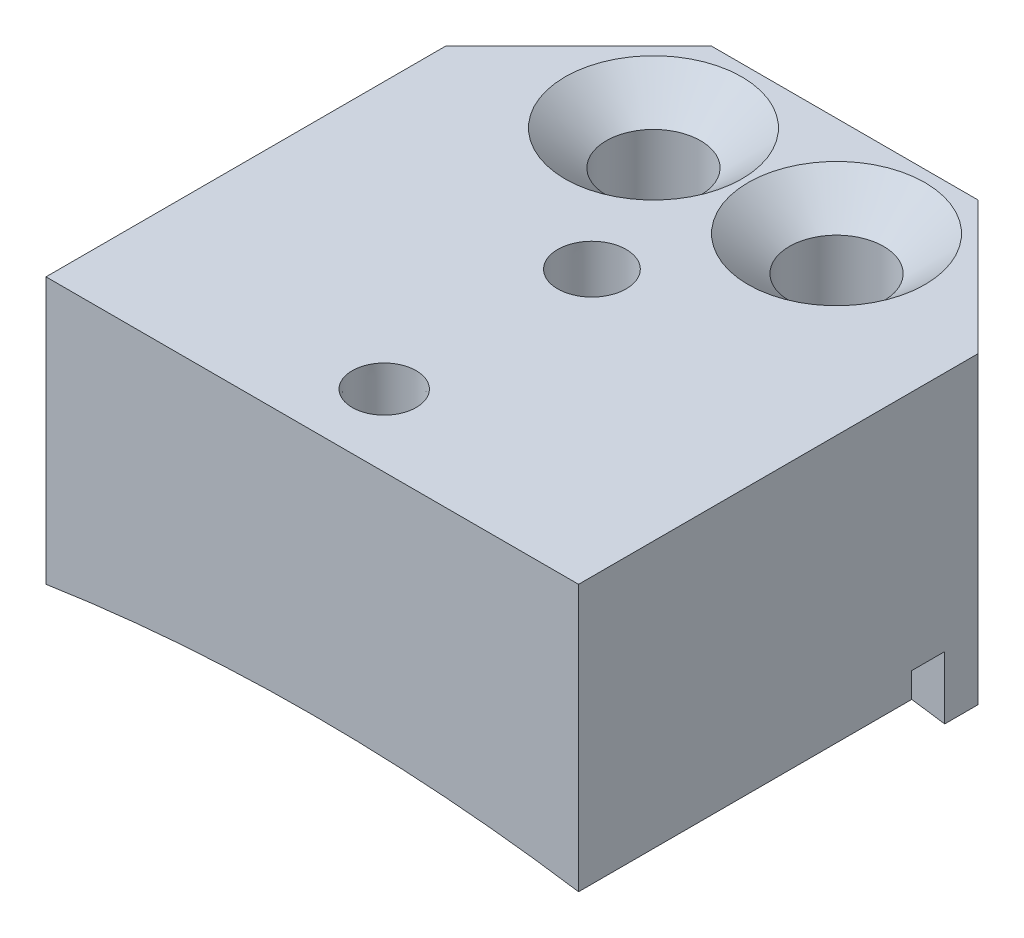
from build123d import *

# Parameters (mm, degrees)
BOSS_EXTRUDE1_DEPTH                               = 12.7
CUT_EXTRUDE1_DEPTH                                = 41.241448839
CUT_EXTRUDE1_DEPTH_BACK                           = 41.241448839
SKETCH2_R                                         = 83.82
BOSS_EXTRUDE2_DEPTH                               = 7.9375
CHAMFER1_SIZE                                     = 6.35
CSK_FOR_8_FLAT_HEAD_MACHINE_SCREW_100_D           = 4.4958
CSK_FOR_8_FLAT_HEAD_MACHINE_SCREW_100_CSINK_D     = 8.4328
CSK_FOR_8_FLAT_HEAD_MACHINE_SCREW_100_CSINK_ANGLE = 100
CUT_EXTRUDE2_DEPTH                                = 35.469591438
SKETCH7_W                                         = 1.5875
SKETCH7_H                                         = 1.190625
CUT_EXTRUDE3_DEPTH                                = 32.168108704


with BuildPart() as part:
    # Sketch1 → Boss-Extrude1 (new body)
    with BuildSketch(Plane(origin=(0, 0, 0), x_dir=(1, 0, 0), z_dir=(0, 1, 0))):
        Polygon((-28.511825699, 6.495271113), (-22.161825699, 12.845271113), (-9.461825699, 12.845271113), (-3.111825699, 6.495271113), (-3.111825699, -12.554728887), (-28.511825699, -12.554728887), align=None)
    extrude(amount=BOSS_EXTRUDE1_DEPTH)

    # Sketch2 → Cut-Extrude1 (cut, two sides: drawn at the far end of the back side and taken through both)
    with BuildSketch(Plane.XY.offset(12.554728887).offset(-CUT_EXTRUDE1_DEPTH_BACK)):
        with Locations((-15.811825699, -82.852292666)):
            Circle(SKETCH2_R)
    extrude(amount=CUT_EXTRUDE1_DEPTH + CUT_EXTRUDE1_DEPTH_BACK, mode=Mode.SUBTRACT)

    # Sketch5 → Boss-Extrude2 (add)
    with BuildSketch(Plane(origin=(0, 0, -12.845271113), x_dir=(-1, 0, 0), z_dir=(0, 0, -1))):
        with BuildLine():
            Line((3.111825699, 12.7), (3.111825699, 0))
            Line((3.111825699, 0), (3.111825699, -1.799225087))
            ThreePointArc((3.111825699, -1.799225087), (15.811825699, -0.810292666), (28.511825699, -1.799225087))
            Line((28.511825699, -1.799225087), (28.511825699, 0))
            Line((28.511825699, 0), (28.511825699, 12.7))
            Line((28.511825699, 12.7), (3.111825699, 12.7))
        make_face()
    extrude(amount=-BOSS_EXTRUDE2_DEPTH)

    # Chamfer1
    chamfer1_edges = [part.edges().sort_by_distance(p)[0] for p in [
        (-28.511825699, 5.450387457, -12.845271113),
        (-3.111825699, 5.450387457, -12.845271113),
    ]]
    chamfer(chamfer1_edges, length=CHAMFER1_SIZE)

    # CSK for #8 Flat Head Machine Screw (100)1 (through all)
    with Locations(Plane(origin=(0, 12.7, 0), x_dir=(1, 0, 0), z_dir=(0, 1, 0))):
        with Locations((-20.177450699, 8.082771113), (-11.446200699, 8.082771113)):
            CounterSinkHole(CSK_FOR_8_FLAT_HEAD_MACHINE_SCREW_100_D / 2, CSK_FOR_8_FLAT_HEAD_MACHINE_SCREW_100_CSINK_D / 2, counter_sink_angle=CSK_FOR_8_FLAT_HEAD_MACHINE_SCREW_100_CSINK_ANGLE)

    # Sketch6 → Cut-Extrude2 (cut, through all)
    with BuildSketch(Plane(origin=(0, 12.7, 0), x_dir=(1, 0, 0), z_dir=(0, 1, 0))):
        with BuildLine():
            add(Edge.make_bspline(
                [(-15.810187161, -10.649728887), (-15.608816069, -10.649728887), (-15.408777087, -10.609258042), (-15.042113414, -10.456913102), (-14.872283136, -10.343310195), (-14.661403237, -10.132093223), (-14.597095235, -10.053567675), (-14.486747252, -9.887951619), (-14.439987535, -9.800364966), (-14.325350321, -9.523041064), (-14.285983587, -9.325167956), (-14.286290626, -9.023681247), (-14.296234835, -8.924756645), (-14.335129975, -8.729941243), (-14.364583859, -8.633021866), (-14.441157352, -8.448760184), (-14.488024203, -8.361269055), (-14.59887818, -8.19554373), (-14.663276798, -8.117242645), (-14.874254427, -7.906673959), (-15.044430287, -7.793212195), (-15.411336895, -7.641510946), (-15.611812582, -7.601658558), (-15.910183793, -7.601764194), (-16.011184079, -7.611765087), (-16.206424053, -7.650777196), (-16.30141986, -7.679610607), (-16.578437934, -7.794438792), (-16.746192198, -7.906327472), (-16.959455446, -8.119808368), (-17.022421419, -8.196790525), (-17.132721662, -8.361961239), (-17.180436007, -8.451221081), (-17.256716781, -8.635734127), (-17.285478891, -8.730735016), (-17.324351045, -8.926195298), (-17.33424011, -9.027147637), (-17.3340816, -9.325321862), (-17.294056516, -9.525871287), (-17.142043719, -9.892631786), (-17.028500472, -10.062651874), (-16.817622682, -10.273567653), (-16.739189096, -10.337937728), (-16.573527751, -10.448531182), (-16.4859941, -10.495341779), (-16.301435, -10.571837459), (-16.204652049, -10.601138186), (-16.009875231, -10.63984903), (-15.910872707, -10.649728887), (-15.810187161, -10.649728887)],
                knots=[0, 0, 0, 0, 0.0625, 0.0625, 0.125, 0.125, 0.15625, 0.15625, 0.1875, 0.1875, 0.25, 0.25, 0.28125, 0.28125, 0.3125, 0.3125, 0.34375, 0.34375, 0.375, 0.375, 0.4375, 0.4375, 0.5, 0.5, 0.53125, 0.53125, 0.5625, 0.5625, 0.625, 0.625, 0.65625, 0.65625, 0.6875, 0.6875, 0.71875, 0.71875, 0.75, 0.75, 0.8125, 0.8125, 0.875, 0.875, 0.90625, 0.90625, 0.9375, 0.9375, 0.96875, 0.96875, 1, 1, 1, 1], degree=3))
        make_face()
        with BuildLine():
            add(Edge.make_bspline(
                [(-17.442014074, 0.780271113), (-17.442014074, 0.564636284), (-17.398676558, 0.350427917), (-17.235540464, -0.042207871), (-17.113890664, -0.224067842), (-16.887712317, -0.449885239), (-16.803624494, -0.518748425), (-16.626277278, -0.636912744), (-16.532486538, -0.686984635), (-16.235518686, -0.809742063), (-16.023629558, -0.851897237), (-15.700787746, -0.851568442), (-15.594856021, -0.840919858), (-15.386241213, -0.799269638), (-15.2824567, -0.767729417), (-15.085143228, -0.685731965), (-14.991454814, -0.635545363), (-14.813990575, -0.51683914), (-14.730143192, -0.447878932), (-14.50465928, -0.22195697), (-14.383160661, -0.039726886), (-14.220713993, 0.353169004), (-14.178038765, 0.567845014), (-14.178151883, 0.887350822), (-14.188861164, 0.995505271), (-14.230636596, 1.204574676), (-14.261512351, 1.30629934), (-14.343486893, 1.504059479), (-14.394580348, 1.59939761), (-14.512809992, 1.776109619), (-14.580489093, 1.858699522), (-14.732890677, 2.010945721), (-14.815325719, 2.078371766), (-14.992196017, 2.196484915), (-15.087778447, 2.247579015), (-15.285361108, 2.329262955), (-15.387091204, 2.360062361), (-15.596396557, 2.401687932), (-15.704499652, 2.412277461), (-16.023794479, 2.412107726), (-16.238549476, 2.369247574), (-16.631288933, 2.206467282), (-16.813352191, 2.084881425), (-17.03920796, 1.859066471), (-17.10813762, 1.77507717), (-17.226564819, 1.597681506), (-17.276691184, 1.503947566), (-17.358605332, 1.306315551), (-17.389981529, 1.202677168), (-17.431434394, 0.994103708), (-17.442014074, 0.888088528), (-17.442014074, 0.780271113)],
                knots=[0, 0, 0, 0, 0.0625, 0.0625, 0.125, 0.125, 0.15625, 0.15625, 0.1875, 0.1875, 0.25, 0.25, 0.28125, 0.28125, 0.3125, 0.3125, 0.34375, 0.34375, 0.375, 0.375, 0.4375, 0.4375, 0.5, 0.5, 0.53125, 0.53125, 0.5625, 0.5625, 0.59375, 0.59375, 0.625, 0.625, 0.65625, 0.65625, 0.6875, 0.6875, 0.71875, 0.71875, 0.75, 0.75, 0.8125, 0.8125, 0.875, 0.875, 0.90625, 0.90625, 0.9375, 0.9375, 0.96875, 0.96875, 1, 1, 1, 1], degree=3))
        make_face()
    extrude(amount=-CUT_EXTRUDE2_DEPTH, mode=Mode.SUBTRACT)

    # Sketch7 → Cut-Extrude3 (cut, through all)
    with BuildSketch(Plane.ZY.offset(28.511825699)):
        with Locations((-4.114021113, 0.5953125)):
            Rectangle(SKETCH7_W, SKETCH7_H)
    extrude(amount=-CUT_EXTRUDE3_DEPTH, mode=Mode.SUBTRACT)


solid = part.part
